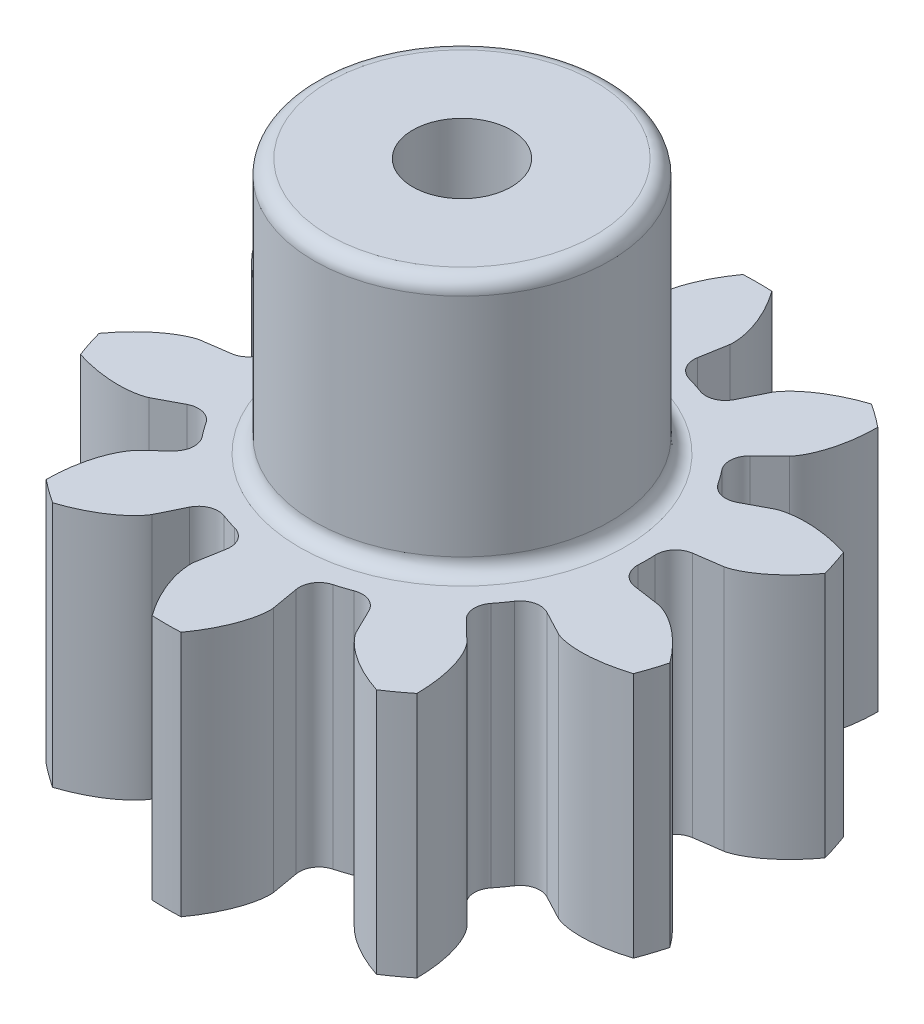
from build123d import *

# Parameters (mm, degrees)
SKETCH2_R                = 15.24
BOSS_EXTRUDE1_DEPTH      = 12.7
CUT_EXTRUDE1_DEPTH       = 26.016098817
FILLET1_R                = 1.016
CIRPATTERN1_COUNT        = 10
FILLET1_OF_CIRPATTERN1_R = 1.016
SKETCH4_R                = 7.62
SKETCH4_R_2              = 2.54
BOSS_EXTRUDE2_DEPTH      = 13.16
SKETCH5_R                = 2.525
CUT_EXTRUDE2_DEPTH       = 25.934859911
FILLET2_R                = 0.762


with BuildPart() as part:
    # Sketch2 → Boss-Extrude1 (new body)
    with BuildSketch(Plane(origin=(0, 0, 0), x_dir=(1, 0, 0), z_dir=(0, 1, 0))):
        Circle(SKETCH2_R)
    extrude(amount=BOSS_EXTRUDE1_DEPTH)

    # Sketch3 → Cut-Extrude1 (cut, through all)
    with BuildSketch(Plane(origin=(0, 0, 0), x_dir=(-1, 0, 0), z_dir=(0, -1, 0))):
        with BuildLine():
            Line((9.428893824, -1.349661534), (11.813682598, -1.691022645))
            add(Edge.make_bspline(
                [(11.813682598, -1.691022645), (11.819178365, -1.691903787), (11.834545167, -1.694660871), (11.863400401, -1.700999964), (11.910150555, -1.712933326), (11.969184939, -1.730464153), (12.04479756, -1.755773638), (12.132910439, -1.7889748), (12.228645625, -1.82897949), (12.331522072, -1.876262838), (12.432952776, -1.926731697), (12.532947922, -1.980115008), (12.631445021, -2.036015147), (12.749370299, -2.106907896), (12.888801103, -2.196315459), (13.048717462, -2.307123688), (13.226338861, -2.440160727), (13.403109396, -2.583451627), (13.573472712, -2.730730451), (13.741256687, -2.886575073), (13.90049908, -3.042342342), (14.06117781, -3.211114463), (14.207107268, -3.370471575), (14.365124352, -3.556498071), (14.491066541, -3.708832868), (14.616438915, -3.872275149), (14.676753563, -3.95271226), (14.707278225, -3.994191683)],
                knots=[0, 0, 0, 0, 0, 0.005376749, 0.015083688, 0.02853182, 0.046610139, 0.064854849, 0.092110525, 0.119476176, 0.146842496, 0.174208854, 0.201574956, 0.228941013, 0.256307345, 0.307035032, 0.361767352, 0.41649966, 0.471231936, 0.525964282, 0.580696615, 0.635428982, 0.690161387, 0.744893688, 0.799626082, 0.854358408, 0.909090915, 0.909090915, 0.909090915, 0.909090915, 0.909090915], degree=4))
            ThreePointArc((14.707278225, -3.994191683), (15.24, 0), (14.707278225, 3.994191683))
            add(Edge.make_bspline(
                [(14.707278225, 3.994191683), (14.676753563, 3.95271226), (14.616438915, 3.872275149), (14.491066541, 3.708832868), (14.365124352, 3.556498071), (14.207107268, 3.370471575), (14.06117781, 3.211114463), (13.90049908, 3.042342342), (13.741256687, 2.886575073), (13.573472712, 2.730730451), (13.403109396, 2.583451627), (13.226338861, 2.440160727), (13.048717462, 2.307123688), (12.888801103, 2.196315459), (12.749370299, 2.106907896), (12.631445021, 2.036015147), (12.532947922, 1.980115008), (12.432952776, 1.926731697), (12.331522072, 1.876262838), (12.228645625, 1.82897949), (12.132910439, 1.7889748), (12.04479756, 1.755773638), (11.969184939, 1.730464153), (11.910150555, 1.712933326), (11.863400401, 1.700999964), (11.834545167, 1.694660871), (11.819178365, 1.691903787), (11.813682598, 1.691022645)],
                knots=[0.190928826, 0.190928826, 0.190928826, 0.190928826, 0.190928826, 0.245661333, 0.300393658, 0.355126053, 0.409858354, 0.464590759, 0.519323125, 0.574055459, 0.628787804, 0.68352008, 0.738252389, 0.792984709, 0.843712396, 0.871078728, 0.898444785, 0.925810887, 0.953177245, 0.980543565, 1.007909216, 1.035164892, 1.053409601, 1.071487921, 1.084936053, 1.094642992, 1.100019741, 1.100019741, 1.100019741, 1.100019741, 1.100019741], degree=4))
            Line((11.813682598, 1.691022645), (9.428893824, 1.349661534))
            ThreePointArc((9.428893824, 1.349661534), (9.525, 0), (9.428893824, -1.349661534))
        make_face()
    cut_extrude1 = extrude(amount=-CUT_EXTRUDE1_DEPTH, mode=Mode.SUBTRACT)

    # Fillet1
    fillet1_edges = [part.edges().sort_by_distance(p)[0] for p in [
        (-9.428893824, 6.35, -1.349661534),
        (-9.428893824, 6.35, 1.349661534),
    ]]
    fillet(fillet1_edges, radius=FILLET1_R)

    # CirPattern1: Cut-Extrude1 ×10 about axis
    cirpattern1_axis = Axis((0, 0, 0), (0, 1, 0))
    for i in range(1, CIRPATTERN1_COUNT):
        add(cut_extrude1.rotate(cirpattern1_axis, i * 360 / CIRPATTERN1_COUNT), mode=Mode.SUBTRACT)

    # Fillet1 of CirPattern1
    fillet1_of_cirpattern1_edges = [part.edges().sort_by_distance(p)[0] for p in [
        (-8.421446487, 6.35, 4.450265617),
        (-6.834824196, 6.35, 6.634063853),
        (-4.197292826, 6.35, 8.550342562),
        (-1.630084033, 6.35, 9.384479263),
        (1.630084033, 6.35, 9.384479263),
        (4.197292826, 6.35, 8.550342562),
        (6.834824196, 6.35, 6.634063853),
        (8.421446487, 6.35, 4.450265617),
        (9.428893824, 6.35, 1.349661534),
        (9.428893824, 6.35, -1.349661534),
        (8.421446487, 6.35, -4.450265617),
        (6.834824196, 6.35, -6.634063853),
        (4.197292826, 6.35, -8.550342562),
        (1.630084033, 6.35, -9.384479263),
        (-1.630084033, 6.35, -9.384479263),
        (-4.197292826, 6.35, -8.550342562),
        (-6.834824196, 6.35, -6.634063853),
        (-8.421446487, 6.35, -4.450265617),
    ]]
    fillet(fillet1_of_cirpattern1_edges, radius=FILLET1_OF_CIRPATTERN1_R)

    # Sketch4 → Boss-Extrude2 (add)
    with BuildSketch(Plane(origin=(0, 12.7, 0), x_dir=(1, 0, 0), z_dir=(0, 1, 0))):
        Circle(SKETCH4_R)
        Circle(SKETCH4_R_2, mode=Mode.SUBTRACT)
    extrude(amount=BOSS_EXTRUDE2_DEPTH)

    # Sketch5 → Cut-Extrude2 (cut, through all)
    with BuildSketch(Plane(origin=(0, 12.7, 0), x_dir=(1, 0, 0), z_dir=(0, 1, 0))):
        Circle(SKETCH5_R)
    extrude(amount=-CUT_EXTRUDE2_DEPTH, mode=Mode.SUBTRACT)

    # Fillet2
    fillet2_edges = [part.edges().sort_by_distance(p)[0] for p in [
        (-7.62, 25.86, 0),
        (-7.62, 12.7, 0),
    ]]
    fillet(fillet2_edges, radius=FILLET2_R)


solid = part.part
